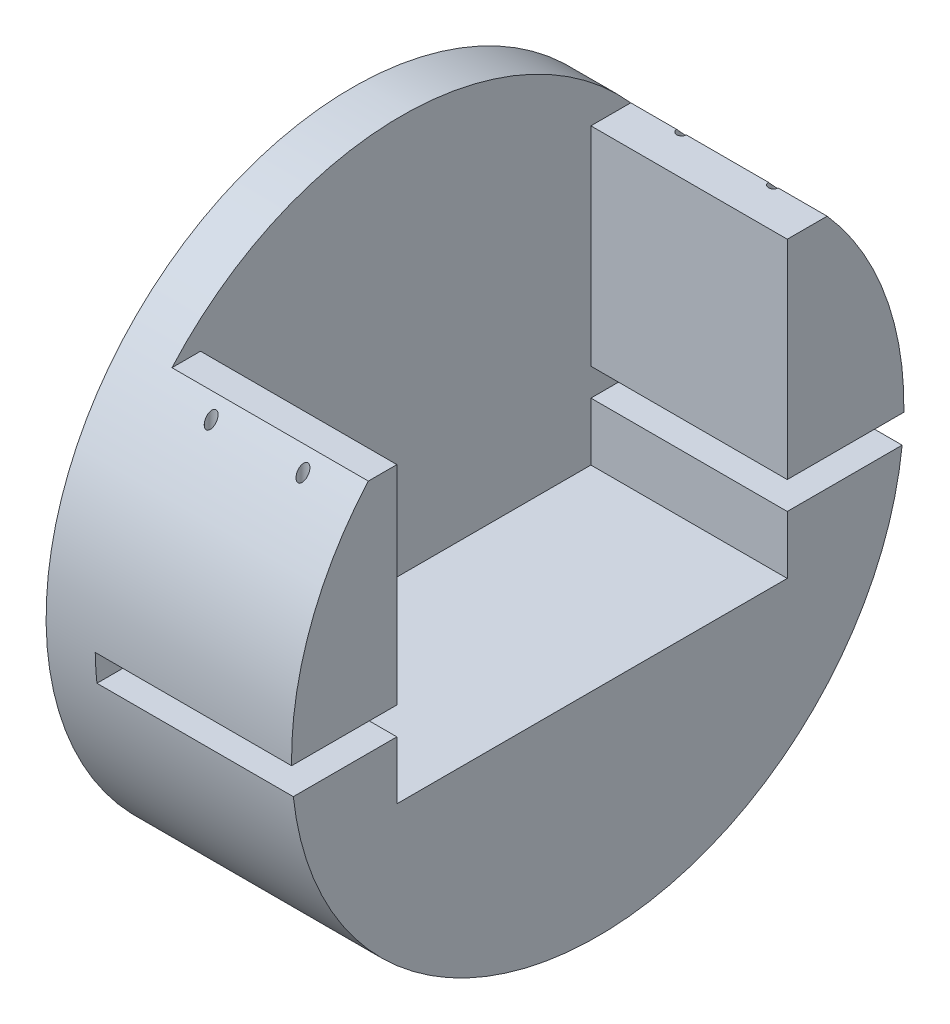
from build123d import *

# Parameters (mm, degrees)
SKETCH1_R           = 31.6865
BOSS_EXTRUDE1_DEPTH = 25.4
CUT_EXTRUDE1_START  = -20.32
CUT_EXTRUDE1_DEPTH  = 20.32
SKETCH5_R           = 0.508
CUT_EXTRUDE2_DEPTH  = 12.7
SKETCH6_R           = 0.508
CUT_EXTRUDE3_DEPTH  = 3.556


with BuildPart() as part:
    # Sketch1 → Boss-Extrude1 (new body)
    with BuildSketch(Plane(origin=(0, 0, 0), x_dir=(0, 0, -1), z_dir=(1, 0, 0))):
        Circle(SKETCH1_R)
    extrude(amount=BOSS_EXTRUDE1_DEPTH)

    # Sketch3 → Cut-Extrude1 (cut)
    with BuildSketch(Plane(origin=(25.4, 0, 0), x_dir=(0, 0, -1), z_dir=(1, 0, 0)).offset(CUT_EXTRUDE1_START)):
        with BuildLine():
            Line((-20.785135478, -0.556), (-31.681621585, -0.556))
            ThreePointArc((-31.681621585, -0.556), (-31.624152047, -1.986778691), (-31.50209993, -3.4135))
            Line((-31.50209993, -3.4135), (-20.785135478, -3.4135))
            Line((-20.785135478, -3.4135), (-20.785135478, -9.415012817))
            Line((-20.785135478, -9.415012817), (19.614864522, -9.415012817))
            Line((19.614864522, -9.415012817), (19.614864522, -3.4135))
            Line((19.614864522, -3.4135), (31.50209993, -3.4135))
            ThreePointArc((31.50209993, -3.4135), (31.624152047, -1.986778691), (31.681621585, -0.556))
            Line((31.681621585, -0.556), (19.614864522, -0.556))
            Line((19.614864522, -0.556), (19.614864522, 20.9865))
            Line((19.614864522, 20.9865), (23.740284329, 20.9865))
            ThreePointArc((23.740284329, 20.9865), (0, 31.6865), (-23.740284329, 20.9865))
            Line((-23.740284329, 20.9865), (-20.785135478, 20.9865))
            Line((-20.785135478, 20.9865), (-20.785135478, -0.556))
        make_face()
    extrude(amount=CUT_EXTRUDE1_DEPTH, mode=Mode.SUBTRACT)

    # Sketch5 → Cut-Extrude2 (cut)
    with BuildSketch(Plane(origin=(0, 20.9865, 0), x_dir=(1, 0, 0), z_dir=(0, 1, 0))):
        with Locations((10.33, -24.932573059)):
            Circle(SKETCH5_R)
        with Locations((19.83, -24.932573059)):
            Circle(SKETCH5_R)
        with Locations((10.33, 23.762302103)):
            Circle(SKETCH5_R)
        with Locations((19.83, 23.762302103)):
            Circle(SKETCH5_R)
    extrude(amount=-CUT_EXTRUDE2_DEPTH, mode=Mode.SUBTRACT)

    # Sketch6 → Cut-Extrude3 (cut)
    with BuildSketch(Plane.ZY):
        with Locations((-1.539927539, 19.940627452)):
            Circle(SKETCH6_R)
    extrude(amount=-CUT_EXTRUDE3_DEPTH, mode=Mode.SUBTRACT)


solid = part.part
